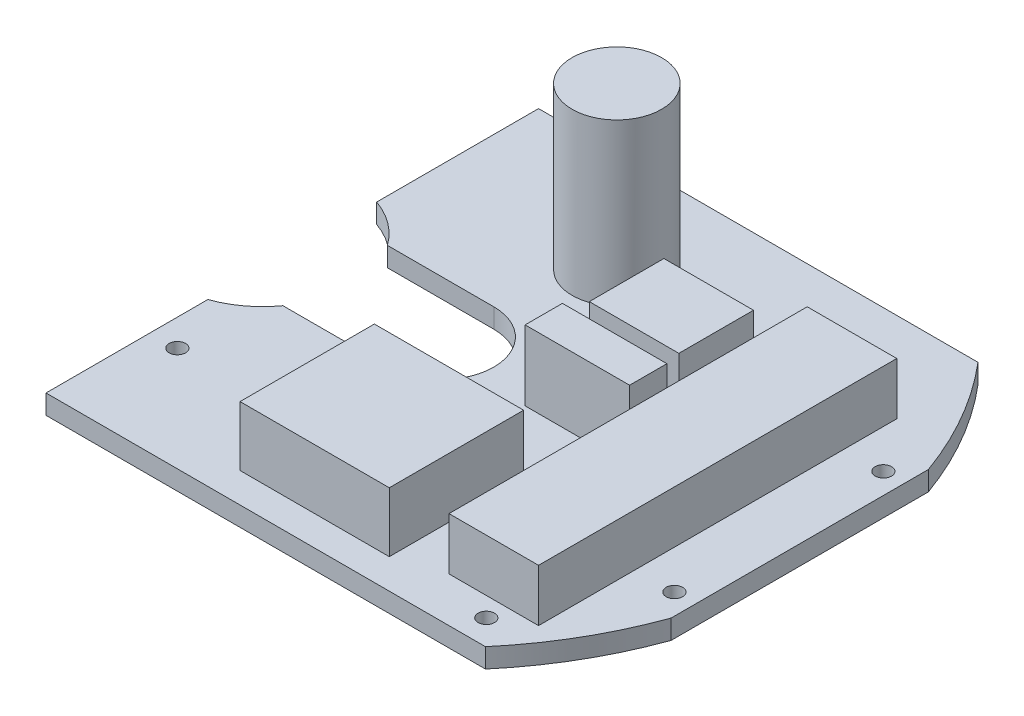
from build123d import *

# Parameters (mm, degrees)
BOSS_EXTRUDE1_DEPTH     = 1.651
CUT_EXTRUDE1_DEPTH      = 75.05047538
CUT_EXTRUDE1_DEPTH_BACK = 75.05047538
SKETCH2_R               = 1.397
SKETCH3_R               = 7.62
BOSS_EXTRUDE2_DEPTH     = 27.432
SKETCH4_W               = 15.24
SKETCH4_H               = 60.96
BOSS_EXTRUDE3_DEPTH     = 8.89
SKETCH5_W               = 25.4
SKETCH5_H               = 22.86
BOSS_EXTRUDE4_DEPTH     = 10.16
SKETCH6_W               = 17.78
SKETCH6_H               = 6.35
BOSS_EXTRUDE5_DEPTH     = 11.938
SKETCH7_W               = 15.24
SKETCH7_H               = 12.7
BOSS_EXTRUDE6_DEPTH     = 8.89


with BuildPart() as part:
    # Sketch1 → Boss-Extrude1 (new, symmetric)
    with BuildSketch(Plane(origin=(0, 0, 0), x_dir=(1, 0, 0), z_dir=(0, 1, 0))):
        with BuildLine():
            Line((49.383244122, 41.91), (-25.4, 41.91))
            Line((-25.4, 41.91), (-25.4, 14.368409794))
            ThreePointArc((-25.4, 14.368409794), (-21.331096915, 12.188321145), (-18.101571182, 8.89))
            Line((-18.101571182, 8.89), (0, 8.89))
            ThreePointArc((0, 8.89), (8.89, 0), (0, -8.89))
            Line((0, -8.89), (-18.101571182, -8.89))
            ThreePointArc((-18.101571182, -8.89), (-21.331096915, -12.188321145), (-25.4, -14.368409794))
            Line((-25.4, -14.368409794), (-25.4, -41.91))
            Line((-25.4, -41.91), (49.383244122, -41.91))
            ThreePointArc((49.383244122, -41.91), (56.072633064, -32.419326354), (60.96, -21.886783683))
            Line((60.96, -21.886783683), (60.96, 21.886783683))
            ThreePointArc((60.96, 21.886783683), (56.072633064, 32.419326354), (49.383244122, 41.91))
        make_face()
    extrude(amount=BOSS_EXTRUDE1_DEPTH, both=True)

    # Sketch2 → Cut-Extrude1 (cut, two sides: drawn at the far end of the back side and taken through both)
    with BuildSketch(Plane(origin=(0, 1.651, 0), x_dir=(1, 0, 0), z_dir=(0, 1, 0)).offset(-CUT_EXTRUDE1_DEPTH_BACK)):
        with Locations((-20.828, -24.13)):
            Circle(SKETCH2_R)
        with Locations((13.462, -19.558)):
            Circle(SKETCH2_R)
        with Locations((45.212, -37.592)):
            Circle(SKETCH2_R)
        with Locations((57.404, -17.78)):
            Circle(SKETCH2_R)
        with Locations((57.404, 17.78)):
            Circle(SKETCH2_R)
        with Locations((-6.35, 29.21)):
            Circle(SKETCH2_R)
    extrude(amount=CUT_EXTRUDE1_DEPTH + CUT_EXTRUDE1_DEPTH_BACK, mode=Mode.SUBTRACT)

    # Sketch3 → Boss-Extrude2 (add)
    with BuildSketch(Plane(origin=(0, 1.651, 0), x_dir=(1, 0, 0), z_dir=(0, 1, 0))):
        with Locations((4.986046711, 24.849793888)):
            Circle(SKETCH3_R)
    extrude(amount=BOSS_EXTRUDE2_DEPTH)

    # Sketch4 → Boss-Extrude3 (add)
    with BuildSketch(Plane(origin=(0, 1.651, 0), x_dir=(1, 0, 0), z_dir=(0, 1, 0))):
        with Locations((43.18, -3.81)):
            Rectangle(SKETCH4_W, SKETCH4_H)
    extrude(amount=BOSS_EXTRUDE3_DEPTH)

    # Sketch5 → Boss-Extrude4 (add)
    with BuildSketch(Plane(origin=(0, 1.651, 0), x_dir=(1, 0, 0), z_dir=(0, 1, 0))):
        with Locations((15.24, -25.4)):
            Rectangle(SKETCH5_W, SKETCH5_H)
    extrude(amount=BOSS_EXTRUDE4_DEPTH)

    # Sketch6 → Boss-Extrude5 (add)
    with BuildSketch(Plane(origin=(0, 1.651, 0), x_dir=(1, 0, 0), z_dir=(0, 1, 0))):
        with Locations((26.162, 0.127)):
            Rectangle(SKETCH6_W, SKETCH6_H)
    extrude(amount=BOSS_EXTRUDE5_DEPTH)

    # Sketch7 → Boss-Extrude6 (add)
    with BuildSketch(Plane(origin=(0, 1.651, 0), x_dir=(1, 0, 0), z_dir=(0, 1, 0))):
        with Locations((23.876, 15.24)):
            Rectangle(SKETCH7_W, SKETCH7_H)
    extrude(amount=BOSS_EXTRUDE6_DEPTH)


solid = part.part
